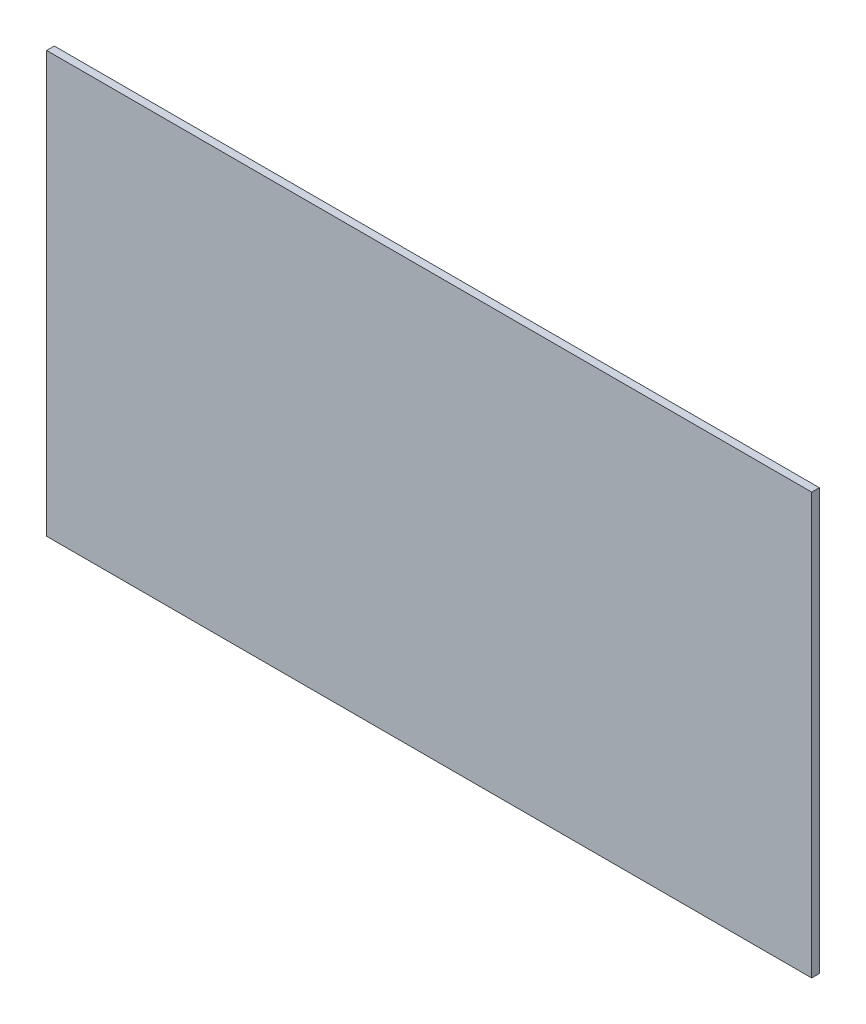
from build123d import *

# Parameters (mm, degrees)
SKETCH1_W           = 400
SKETCH1_H           = 220
BOSS_EXTRUDE1_DEPTH = 4


with BuildPart() as part:
    # Sketch1 → Boss-Extrude1 (new body)
    with BuildSketch(Plane.XY):
        Rectangle(SKETCH1_W, SKETCH1_H)
    extrude(amount=BOSS_EXTRUDE1_DEPTH)


solid = part.part
